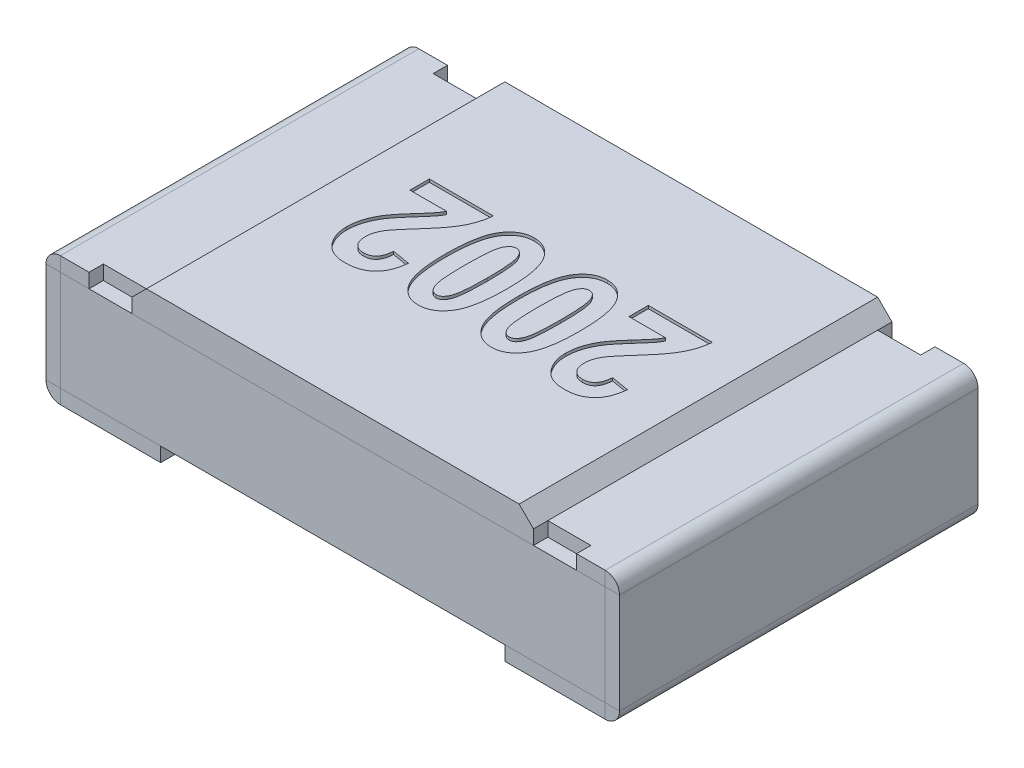
from build123d import *

# Parameters (mm, degrees)
SKETCH1_W              = 1.9
SKETCH1_H              = 1.25
BOSS_EXTRUDE1_DEPTH    = 0.35
SKETCH2_W              = 0.35
SKETCH2_H              = 1.25
BASE_FLANGE1_DEPTH     = 0.05
SM_START               = -0.625
SM_EDGE_FLANGE_1_DEPTH = 1.25
SM_EDGE_FLANGE_2_DEPTH = 1.25
SKETCH14_W             = 0.15
SKETCH14_H             = 0.05
CUT_EXTRUDE1_DEPTH     = 0.05
SKETCH17_W             = 1.4
SKETCH17_H             = 1.25
BOSS_EXTRUDE3_DEPTH    = 0.1
CHAMFER1_SIZE          = 0.05
CUT_EXTRUDE2_DEPTH     = 0.01


# Read off the part's stored shape, not the designer's step: Ребро-кромка1, Ребро-кромка2
# Sheet-metal steps are written as plain solids
with BuildPart() as part:
    # Sketch1 → Boss-Extrude1 (new body)
    with BuildSketch(Plane(origin=(0, 0.05, 0), x_dir=(1, 0, 0), z_dir=(0, 1, 0))):
        Rectangle(SKETCH1_W, SKETCH1_H)
    extrude(amount=BOSS_EXTRUDE1_DEPTH)


with BuildPart() as body_2:
    # Sketch2 → Base-Flange1 (new body)
    with BuildSketch(Plane(origin=(0, 0.05, 0), x_dir=(1, 0, 0), z_dir=(0, 1, 0))):
        with Locations((0.775, 0)):
            Rectangle(SKETCH2_W, SKETCH2_H)
    extrude(amount=-BASE_FLANGE1_DEPTH)

    # Ребро-кромка1 outline → Ребро-кромка1 (add)
    with BuildSketch(Plane.XY.offset(SM_START)):
        with BuildLine():
            Line((0.95, 0.4), (0.95, 0))
            ThreePointArc((0.95, 0), (0.985355339, 0.014644661), (1, 0.05))
            Line((1, 0.05), (1, 0.4))
            Line((1, 0.4), (0.95, 0.4))
        make_face()
    extrude(amount=SM_EDGE_FLANGE_1_DEPTH)

    # Ребро-кромка2 outline → Ребро-кромка2 (add)
    with BuildSketch(Plane.XY.offset(SM_START)):
        with BuildLine():
            Line((0.7, 0.4), (1, 0.4))
            ThreePointArc((1, 0.4), (0.985355339, 0.435355339), (0.95, 0.45))
            Line((0.95, 0.45), (0.7, 0.45))
            Line((0.7, 0.45), (0.7, 0.4))
        make_face()
    extrude(amount=SM_EDGE_FLANGE_2_DEPTH)

    # Sketch14 → Cut-Extrude1 (cut)
    with BuildSketch(Plane(origin=(0, 0.45, 0), x_dir=(1, 0, 0), z_dir=(0, 1, 0))):
        with Locations((0.775, -0.6)):
            Rectangle(SKETCH14_W, SKETCH14_H)
        with Locations((0.775, 0.6)):
            Rectangle(SKETCH14_W, SKETCH14_H)
    extrude(amount=-CUT_EXTRUDE1_DEPTH, mode=Mode.SUBTRACT)


with BuildPart() as body_3:
    # Mirror1: mirrored copy
    add(body_2.part.mirror(Plane(origin=(0, 0, 0), x_dir=(0, 0, 1), z_dir=(1, 0, 0))))


with BuildPart() as body_4:
    # Sketch17 → Boss-Extrude3 (new body)
    with BuildSketch(Plane(origin=(0, 0.4, 0), x_dir=(1, 0, 0), z_dir=(0, 1, 0))):
        Rectangle(SKETCH17_W, SKETCH17_H)
    extrude(amount=BOSS_EXTRUDE3_DEPTH)

    # Chamfer1
    chamfer1_edges = [body_4.edges().sort_by_distance(p)[0] for p in [
        (-0.7, 0.5, 0),
        (0.7, 0.5, 0),
    ]]
    chamfer(chamfer1_edges, length=CHAMFER1_SIZE)

    # Sketch18<2> → Cut-Extrude2 (cut)
    # profile 1 of 4: a face of its own
    with BuildSketch(Plane(origin=(0, 0.5, 0), x_dir=(1, 0, 0), z_dir=(0, 1, 0))):
        with BuildLine():
            Line((0.275324675, 0.132467532), (0.275324675, 0.2))
            Line((0.275324675, 0.2), (0.498701299, 0.2))
            add(Edge.make_bspline(
                [(0.498701299, 0.2), (0.497913144, 0.193349508), (0.496338975, 0.180066594), (0.491616722, 0.160549241), (0.485079536, 0.141537011), (0.478091948, 0.126008074), (0.471123534, 0.113487658), (0.464901061, 0.103265946), (0.457471014, 0.09242231), (0.448974646, 0.080854871), (0.439423397, 0.068564316), (0.42875224, 0.055552761), (0.416979456, 0.041856121), (0.408674017, 0.032561624), (0.404383117, 0.02775974)],
                knots=[0, 0, 0, 0, 1.202815009, 2.402362028, 3.600330928, 4.812516718, 5.456765873, 6.174838876, 6.962514926, 7.818431152, 8.754172199, 9.759747227, 10.84260169, 12, 12, 12, 12], degree=3))
            add(Edge.make_bspline(
                [(0.404383117, 0.02775974), (0.401018629, 0.024007293), (0.394582064, 0.016828525), (0.385528476, 0.006432996), (0.377384801, -0.002915116), (0.370410567, -0.011408794), (0.364360025, -0.018870442), (0.359345611, -0.025413804), (0.355307188, -0.030982158), (0.35314865, -0.034485558), (0.352191558, -0.036038961)],
                knots=[0, 0, 0, 0, 1.465870871, 2.804341841, 4.009590698, 5.071600616, 6.000740577, 6.80347298, 7.469461756, 8, 8, 8, 8], degree=3))
            add(Edge.make_bspline(
                [(0.352191558, -0.036038961), (0.349970292, -0.04001807), (0.345634331, -0.047785379), (0.341119113, -0.060094055), (0.338167782, -0.072424923), (0.337829574, -0.080719786), (0.337662338, -0.084821429)],
                knots=[0, 0, 0, 0, 1.060288104, 2.069705834, 3.04550853, 4, 4, 4, 4], degree=3))
            add(Edge.make_bspline(
                [(0.337662338, -0.084821429), (0.337805275, -0.088919664), (0.338075865, -0.096677885), (0.340417276, -0.107540843), (0.344288335, -0.11687167), (0.349836809, -0.124536437), (0.356741694, -0.130416221), (0.364681712, -0.134669341), (0.373596293, -0.137256403), (0.379879572, -0.137524307), (0.383116883, -0.137662338)],
                knots=[0, 0, 0, 0, 1.245032197, 2.356925714, 3.359432541, 4.295783246, 5.205998414, 6.09309012, 7.017509524, 8, 8, 8, 8], degree=3))
            add(Edge.make_bspline(
                [(0.383116883, -0.137662338), (0.386626091, -0.137508436), (0.393352103, -0.137213456), (0.402820721, -0.134483693), (0.411024407, -0.129937787), (0.417849207, -0.123474175), (0.42325916, -0.115205511), (0.427275216, -0.105189479), (0.429998523, -0.093442161), (0.430763175, -0.084998779), (0.431168831, -0.080519481)],
                knots=[0, 0, 0, 0, 0.999757542, 1.91621054, 2.784003759, 3.652621159, 4.571413543, 5.582410499, 6.717444591, 8, 8, 8, 8], degree=3))
            Line((0.431168831, -0.080519481), (0.493506494, -0.090909091))
            add(Edge.make_bspline(
                [(0.493506494, -0.090909091), (0.492984489, -0.095465963), (0.491971861, -0.104305756), (0.489290707, -0.117003045), (0.48611466, -0.128804701), (0.482140614, -0.139652209), (0.477418529, -0.149550889), (0.471964253, -0.158534612), (0.465798056, -0.166629062), (0.458838611, -0.173728988), (0.451238045, -0.179914446), (0.44308188, -0.185302842), (0.434328247, -0.189876897), (0.424979825, -0.193626842), (0.414977914, -0.196426786), (0.404432524, -0.198565387), (0.393264088, -0.199772732), (0.385635908, -0.199923129), (0.381737013, -0.2)],
                knots=[0, 0, 0, 0, 1.257277449, 2.438969413, 3.555122979, 4.606890186, 5.602584943, 6.558324939, 7.484454118, 8.387006599, 9.278232025, 10.16732337, 11.063477837, 11.98256456, 12.924375971, 13.908137147, 14.9308127, 16, 16, 16, 16], degree=3))
            add(Edge.make_bspline(
                [(0.381737013, -0.2), (0.377457958, -0.199882858), (0.369168573, -0.19965593), (0.357108762, -0.198133762), (0.345915206, -0.195442015), (0.335445696, -0.191811353), (0.325864632, -0.186967377), (0.316968025, -0.181227321), (0.309085121, -0.174197213), (0.301946521, -0.166364549), (0.29578418, -0.157749319), (0.290341489, -0.148818521), (0.285619421, -0.139603258), (0.281975655, -0.129985677), (0.278846879, -0.120156439), (0.276937183, -0.109956897), (0.275514033, -0.099498792), (0.275388449, -0.092402383), (0.275324675, -0.088798701)],
                knots=[0, 0, 0, 0, 1.186211717, 2.297928972, 3.362154236, 4.3727221, 5.362223315, 6.331622294, 7.298958998, 8.281270799, 9.263926147, 10.229953495, 11.179209739, 12.12911764, 13.078136807, 14.034242713, 15.001753863, 16, 16, 16, 16], degree=3))
            add(Edge.make_bspline(
                [(0.275324675, -0.088798701), (0.275394591, -0.084709483), (0.275533855, -0.076564232), (0.276903181, -0.064471278), (0.278984695, -0.052554344), (0.282018315, -0.040810172), (0.285959968, -0.029134129), (0.290757054, -0.017449199), (0.296441894, -0.005717513), (0.302039698, 0.004002911), (0.307055473, 0.012078481), (0.31152186, 0.018533348), (0.316611977, 0.025365694), (0.322183114, 0.032690481), (0.328453718, 0.040366713), (0.335270872, 0.048485742), (0.342658413, 0.057009415), (0.347827065, 0.06277804), (0.350487013, 0.065746753)],
                knots=[0, 0, 0, 0, 1.112563442, 2.216097518, 3.308146812, 4.402998112, 5.513781081, 6.65974264, 7.838800208, 9.05908204, 9.710862989, 10.42577165, 11.194588916, 12.029705768, 12.930215825, 13.891935437, 14.915124831, 16, 16, 16, 16], degree=3))
            add(Edge.make_bspline(
                [(0.350487013, 0.065746753), (0.3529571, 0.068472335), (0.357679959, 0.073683706), (0.36428664, 0.081222163), (0.370238965, 0.087986292), (0.375510433, 0.093972901), (0.380092428, 0.099245989), (0.383865467, 0.103854386), (0.386975681, 0.107697587), (0.391544801, 0.113426355), (0.397004356, 0.121495164), (0.400952044, 0.12891658), (0.402840909, 0.132467532)],
                knots=[0, 0, 0, 0, 1.297119841, 2.480120354, 3.534763852, 4.474517179, 5.293121491, 5.998013172, 6.574687284, 7.036626064, 8.582103637, 10, 10, 10, 10], degree=3))
            Line((0.402840909, 0.132467532), (0.275324675, 0.132467532))
        make_face()
    # profile 2 of 4: a face of its own
    with BuildSketch(Plane(origin=(0, 0.5, 0), x_dir=(1, 0, 0), z_dir=(0, 1, 0))):
        with BuildLine():
            add(Edge.make_bspline(
                [(0.127435065, -0.2), (0.123556318, -0.199857434), (0.115902711, -0.19957612), (0.104735887, -0.197413383), (0.094105107, -0.193899722), (0.084083819, -0.188915172), (0.074665899, -0.182495134), (0.065827688, -0.174678766), (0.057562257, -0.165469418), (0.049816451, -0.154784436), (0.042855814, -0.142287813), (0.03691096, -0.127754663), (0.031918262, -0.111134807), (0.02784994, -0.092430259), (0.024622662, -0.071614446), (0.022437108, -0.048685459), (0.021045624, -0.023664395), (0.020870348, -0.006279065), (0.020779221, 0.00275974)],
                knots=[0, 0, 0, 0, 0.727503026, 1.435521033, 2.125933754, 2.823035237, 3.52857293, 4.258887692, 5.031802202, 5.846339271, 6.730577678, 7.709342118, 8.787052798, 9.983216815, 11.298799232, 12.737663191, 14.303878888, 16, 16, 16, 16], degree=3))
            add(Edge.make_bspline(
                [(0.020779221, 0.00275974), (0.020870548, 0.011771451), (0.021046187, 0.029102634), (0.022434565, 0.054043203), (0.024632394, 0.076915874), (0.027833454, 0.097683332), (0.031950604, 0.116374335), (0.036872915, 0.132990657), (0.042879948, 0.147499029), (0.049808946, 0.159984707), (0.057569123, 0.170634273), (0.065744551, 0.179898955), (0.074587199, 0.187689606), (0.08398713, 0.194085522), (0.093959423, 0.199116834), (0.10452607, 0.20257983), (0.11562846, 0.204786725), (0.123230712, 0.205056917), (0.12711039, 0.205194805)],
                knots=[0, 0, 0, 0, 1.695059366, 3.259911835, 4.697127445, 6.015833273, 7.209868934, 8.295006778, 9.271397414, 10.15773515, 10.974206064, 11.745554658, 12.477603308, 13.184816065, 13.879016739, 14.571068615, 15.270769761, 16, 16, 16, 16], degree=3))
            add(Edge.make_bspline(
                [(0.12711039, 0.205194805), (0.130987127, 0.205042453), (0.138631819, 0.204742025), (0.149822721, 0.202721873), (0.16041548, 0.199148087), (0.170486818, 0.19429561), (0.179850815, 0.187842178), (0.188719121, 0.180126252), (0.196988962, 0.170995059), (0.203282887, 0.162318013), (0.208013912, 0.154643874), (0.211314495, 0.148225461), (0.214390672, 0.141273959), (0.2173518, 0.133828826), (0.21988857, 0.125744214), (0.222338239, 0.117174056), (0.224521405, 0.10807297), (0.226450622, 0.098427606), (0.228272862, 0.088263723), (0.229664037, 0.077500558), (0.231024836, 0.066254389), (0.231930447, 0.054416131), (0.232777374, 0.042080629), (0.233299339, 0.029169507), (0.233767992, 0.015750096), (0.233766827, 0.006602198), (0.233766234, 0.001948052)],
                knots=[0, 0, 0, 0, 1.088282887, 2.146027983, 3.178826917, 4.218279349, 5.273703959, 6.361191414, 7.511779163, 8.724110884, 9.365006532, 10.041034625, 10.748217649, 11.498582071, 12.288826199, 13.125555753, 14.000603745, 14.915204017, 15.88669545, 16.898559194, 17.961282966, 19.066372579, 20.230939374, 21.432180567, 22.693579123, 24, 24, 24, 24], degree=3))
            add(Edge.make_bspline(
                [(0.233766234, 0.001948052), (0.233675171, -0.007036653), (0.233500062, -0.024313857), (0.232108657, -0.049172772), (0.229924189, -0.071939776), (0.226690725, -0.092619949), (0.222611933, -0.111238668), (0.217655644, -0.12781776), (0.211667116, -0.142304698), (0.204736131, -0.154789791), (0.196976424, -0.165439494), (0.188800881, -0.174704143), (0.179958261, -0.182494803), (0.170558323, -0.188890716), (0.160586032, -0.193922029), (0.150019384, -0.197385024), (0.138916995, -0.199591919), (0.131314742, -0.199862112), (0.127435065, -0.2)],
                knots=[0, 0, 0, 0, 1.69316225, 3.255878705, 4.690734649, 6.001855936, 7.198146525, 8.280455951, 9.258690493, 10.146702072, 10.964714887, 11.737520167, 12.470951286, 13.179499609, 13.875011277, 14.568370088, 15.269392615, 16, 16, 16, 16], degree=3))
        make_face()
        with BuildLine():
            add(Edge.make_bspline(
                [(0.127272727, -0.137662338), (0.128714309, -0.137579426), (0.131588032, -0.137414146), (0.135767049, -0.136228507), (0.139743954, -0.134342522), (0.143440872, -0.131595888), (0.146815972, -0.128060086), (0.150030129, -0.123841879), (0.153020548, -0.118862777), (0.155866854, -0.112915556), (0.158487593, -0.105498009), (0.160408604, -0.096123943), (0.1623201, -0.084763042), (0.163665778, -0.071282468), (0.164921507, -0.055753966), (0.165659799, -0.03810098), (0.166156133, -0.018374202), (0.166207029, -0.004518801), (0.166233766, 0.00275974)],
                knots=[0, 0, 0, 0, 0.441218712, 0.87954774, 1.320688601, 1.783190269, 2.281372209, 2.813490262, 3.404797085, 4.057243347, 4.830526213, 5.807711728, 6.983597402, 8.359244128, 9.955404635, 11.755826947, 13.770444526, 16, 16, 16, 16], degree=3))
            add(Edge.make_bspline(
                [(0.166233766, 0.00275974), (0.166207368, 0.010038289), (0.166157213, 0.023866658), (0.165658081, 0.043566305), (0.164921925, 0.061192294), (0.163664804, 0.076720737), (0.162325585, 0.090174901), (0.1604143, 0.101483305), (0.158470708, 0.110796177), (0.155888349, 0.118173993), (0.153004851, 0.124079249), (0.149999378, 0.129038546), (0.146871349, 0.133330841), (0.143409471, 0.136787239), (0.139747877, 0.13954104), (0.135766031, 0.141422349), (0.131588287, 0.142609193), (0.128714395, 0.142774312), (0.127272727, 0.142857143)],
                knots=[0, 0, 0, 0, 2.233925394, 4.24418983, 6.048140963, 7.647429939, 9.025772927, 10.195769628, 11.166772259, 11.941570756, 12.587815933, 13.180281715, 13.720062895, 14.213314685, 14.676722855, 15.11872835, 15.557916501, 16, 16, 16, 16], degree=3))
            add(Edge.make_bspline(
                [(0.127272727, 0.142857143), (0.125804058, 0.142776027), (0.122903125, 0.142615807), (0.118694432, 0.141426978), (0.114711298, 0.139513267), (0.110944748, 0.136822484), (0.10755397, 0.13321627), (0.104273848, 0.12901585), (0.101387119, 0.123946403), (0.098489074, 0.11805017), (0.096024481, 0.110613355), (0.094037326, 0.101325268), (0.092147623, 0.090010737), (0.090777761, 0.076589538), (0.089654105, 0.061079587), (0.088877342, 0.043485936), (0.088391872, 0.023812302), (0.088339307, 0.010011149), (0.088311688, 0.00275974)],
                knots=[0, 0, 0, 0, 0.450092843, 0.889028465, 1.330779811, 1.80063996, 2.299511324, 2.844002349, 3.431866051, 4.085215219, 4.856850318, 5.827294631, 6.996618595, 8.374169049, 9.963635982, 11.76654986, 13.775658413, 16, 16, 16, 16], degree=3))
            add(Edge.make_bspline(
                [(0.088311688, 0.00275974), (0.088339537, -0.004518712), (0.088392551, -0.018373944), (0.088874682, -0.038101858), (0.089658547, -0.055749157), (0.090772236, -0.071286968), (0.092154147, -0.084760881), (0.0940409, -0.096129183), (0.096013266, -0.105474933), (0.098488057, -0.112937699), (0.101392127, -0.118828813), (0.104246664, -0.123896444), (0.107581177, -0.12802736), (0.110941704, -0.131630043), (0.114712039, -0.134317885), (0.118694241, -0.136232321), (0.122903174, -0.137420964), (0.125804074, -0.137581209), (0.127272727, -0.137662338)],
                knots=[0, 0, 0, 0, 2.227823008, 4.240875137, 6.039898439, 7.634194999, 9.008772785, 10.183744742, 11.16017094, 11.930140898, 12.582080179, 13.168675308, 13.705450879, 14.203245709, 14.672091929, 15.112890003, 15.55087843, 16, 16, 16, 16], degree=3))
        make_face(mode=Mode.SUBTRACT)
    # profile 3 of 4: a face of its own
    with BuildSketch(Plane(origin=(0, 0.5, 0), x_dir=(1, 0, 0), z_dir=(0, 1, 0))):
        with BuildLine():
            add(Edge.make_bspline(
                [(-0.12711039, -0.2), (-0.130989136, -0.199857434), (-0.138642743, -0.19957612), (-0.149809568, -0.197413383), (-0.160440347, -0.193899722), (-0.170461636, -0.188915172), (-0.179879555, -0.182495134), (-0.188717767, -0.174678766), (-0.196983198, -0.165469418), (-0.204729003, -0.154784436), (-0.211689641, -0.142287813), (-0.217634495, -0.127754663), (-0.222627192, -0.111134807), (-0.226695515, -0.092430259), (-0.229922793, -0.071614446), (-0.232108347, -0.048685459), (-0.23349983, -0.023664395), (-0.233675106, -0.006279065), (-0.233766234, 0.00275974)],
                knots=[0, 0, 0, 0, 0.727503026, 1.435521033, 2.125933754, 2.823035237, 3.52857293, 4.258887692, 5.031802202, 5.846339271, 6.730577678, 7.709342118, 8.787052798, 9.983216815, 11.298799232, 12.737663191, 14.303878888, 16, 16, 16, 16], degree=3))
            add(Edge.make_bspline(
                [(-0.233766234, 0.00275974), (-0.233674907, 0.011771451), (-0.233499268, 0.029102634), (-0.23211089, 0.054043203), (-0.229913061, 0.076915874), (-0.226712, 0.097683332), (-0.22259485, 0.116374335), (-0.217672539, 0.132990657), (-0.211665506, 0.147499029), (-0.204736509, 0.159984707), (-0.196976332, 0.170634273), (-0.188800903, 0.179898955), (-0.179958255, 0.187689606), (-0.170558325, 0.194085522), (-0.160586032, 0.199116834), (-0.150019384, 0.20257983), (-0.138916995, 0.204786725), (-0.131314742, 0.205056917), (-0.127435065, 0.205194805)],
                knots=[0, 0, 0, 0, 1.695059366, 3.259911835, 4.697127445, 6.015833273, 7.209868934, 8.295006778, 9.271397414, 10.15773515, 10.974206064, 11.745554658, 12.477603308, 13.184816065, 13.879016739, 14.571068615, 15.270769761, 16, 16, 16, 16], degree=3))
            add(Edge.make_bspline(
                [(-0.127435065, 0.205194805), (-0.123558328, 0.205042453), (-0.115913636, 0.204742025), (-0.104722733, 0.202721873), (-0.094129975, 0.199148087), (-0.084058636, 0.19429561), (-0.074694639, 0.187842178), (-0.065826333, 0.180126252), (-0.057556493, 0.170995059), (-0.051262568, 0.162318013), (-0.046531542, 0.154643874), (-0.04323096, 0.148225461), (-0.040154783, 0.141273959), (-0.037193654, 0.133828826), (-0.034656884, 0.125744214), (-0.032207216, 0.117174056), (-0.03002405, 0.10807297), (-0.028094833, 0.098427606), (-0.026272593, 0.088263723), (-0.024881418, 0.077500558), (-0.023520619, 0.066254389), (-0.022615007, 0.054416131), (-0.021768081, 0.042080629), (-0.021246115, 0.029169507), (-0.020777463, 0.015750096), (-0.020778628, 0.006602198), (-0.020779221, 0.001948052)],
                knots=[0, 0, 0, 0, 1.088282887, 2.146027983, 3.178826917, 4.218279349, 5.273703959, 6.361191414, 7.511779163, 8.724110884, 9.365006532, 10.041034625, 10.748217649, 11.498582071, 12.288826199, 13.125555753, 14.000603745, 14.915204017, 15.88669545, 16.898559194, 17.961282966, 19.066372579, 20.230939374, 21.432180567, 22.693579123, 24, 24, 24, 24], degree=3))
            add(Edge.make_bspline(
                [(-0.020779221, 0.001948052), (-0.020870283, -0.007036653), (-0.021045393, -0.024313857), (-0.022436797, -0.049172772), (-0.024621265, -0.071939776), (-0.02785473, -0.092619949), (-0.031933521, -0.111238668), (-0.036889811, -0.12781776), (-0.042878338, -0.142304698), (-0.049809324, -0.154789791), (-0.057569031, -0.165439494), (-0.065744574, -0.174704143), (-0.074587194, -0.182494803), (-0.083987131, -0.188890716), (-0.093959423, -0.193922029), (-0.10452607, -0.197385024), (-0.11562846, -0.199591919), (-0.123230712, -0.199862112), (-0.12711039, -0.2)],
                knots=[0, 0, 0, 0, 1.69316225, 3.255878705, 4.690734649, 6.001855936, 7.198146525, 8.280455951, 9.258690493, 10.146702072, 10.964714887, 11.737520167, 12.470951286, 13.179499609, 13.875011277, 14.568370088, 15.269392615, 16, 16, 16, 16], degree=3))
        make_face()
        with BuildLine():
            add(Edge.make_bspline(
                [(-0.127272727, -0.137662338), (-0.125831145, -0.137579426), (-0.122957423, -0.137414146), (-0.118778406, -0.136228507), (-0.1148015, -0.134342522), (-0.111104583, -0.131595888), (-0.107729482, -0.128060086), (-0.104515325, -0.123841879), (-0.101524907, -0.118862777), (-0.098678601, -0.112915556), (-0.096057861, -0.105498009), (-0.094136851, -0.096123943), (-0.092225354, -0.084763042), (-0.090879677, -0.071282468), (-0.089623947, -0.055753966), (-0.088885656, -0.03810098), (-0.088389321, -0.018374202), (-0.088338425, -0.004518801), (-0.088311688, 0.00275974)],
                knots=[0, 0, 0, 0, 0.441218712, 0.87954774, 1.320688601, 1.783190269, 2.281372209, 2.813490262, 3.404797085, 4.057243347, 4.830526213, 5.807711728, 6.983597402, 8.359244128, 9.955404635, 11.755826947, 13.770444526, 16, 16, 16, 16], degree=3))
            add(Edge.make_bspline(
                [(-0.088311688, 0.00275974), (-0.088338087, 0.010038289), (-0.088388241, 0.023866658), (-0.088887373, 0.043566305), (-0.089623529, 0.061192294), (-0.09088065, 0.076720737), (-0.092219869, 0.090174901), (-0.094131154, 0.101483305), (-0.096074747, 0.110796177), (-0.098657106, 0.118173993), (-0.101540604, 0.124079249), (-0.104546077, 0.129038546), (-0.107674105, 0.133330841), (-0.111135984, 0.136787239), (-0.114797578, 0.13954104), (-0.118779423, 0.141422349), (-0.122957167, 0.142609193), (-0.12583106, 0.142774312), (-0.127272727, 0.142857143)],
                knots=[0, 0, 0, 0, 2.233925394, 4.24418983, 6.048140963, 7.647429939, 9.025772927, 10.195769628, 11.166772259, 11.941570756, 12.587815933, 13.180281715, 13.720062895, 14.213314685, 14.676722855, 15.11872835, 15.557916501, 16, 16, 16, 16], degree=3))
            add(Edge.make_bspline(
                [(-0.127272727, 0.142857143), (-0.128741397, 0.142776027), (-0.13164233, 0.142615807), (-0.135851023, 0.141426978), (-0.139834157, 0.139513267), (-0.143600707, 0.136822484), (-0.146991484, 0.13321627), (-0.150271607, 0.12901585), (-0.153158336, 0.123946403), (-0.15605638, 0.11805017), (-0.158520973, 0.110613355), (-0.160508129, 0.101325268), (-0.162397832, 0.090010737), (-0.163767693, 0.076589538), (-0.16489135, 0.061079587), (-0.165668112, 0.043485936), (-0.166153583, 0.023812302), (-0.166206148, 0.010011149), (-0.166233766, 0.00275974)],
                knots=[0, 0, 0, 0, 0.450092843, 0.889028465, 1.330779811, 1.80063996, 2.299511324, 2.844002349, 3.431866051, 4.085215219, 4.856850318, 5.827294631, 6.996618595, 8.374169049, 9.963635982, 11.76654986, 13.775658413, 16, 16, 16, 16], degree=3))
            add(Edge.make_bspline(
                [(-0.166233766, 0.00275974), (-0.166205917, -0.004518712), (-0.166152904, -0.018373944), (-0.165670773, -0.038101858), (-0.164886907, -0.055749157), (-0.163773218, -0.071286968), (-0.162391307, -0.084760881), (-0.160504554, -0.096129183), (-0.158532189, -0.105474933), (-0.156057398, -0.112937699), (-0.153153328, -0.118828813), (-0.15029879, -0.123896444), (-0.146964278, -0.12802736), (-0.14360375, -0.131630043), (-0.139833415, -0.134317885), (-0.135851214, -0.136232321), (-0.131642281, -0.137420964), (-0.12874138, -0.137581209), (-0.127272727, -0.137662338)],
                knots=[0, 0, 0, 0, 2.227823008, 4.240875137, 6.039898439, 7.634194999, 9.008772785, 10.183744742, 11.16017094, 11.930140898, 12.582080179, 13.168675308, 13.705450879, 14.203245709, 14.672091929, 15.112890003, 15.55087843, 16, 16, 16, 16], degree=3))
        make_face(mode=Mode.SUBTRACT)
    # profile 4 of 4: a face of its own
    with BuildSketch(Plane(origin=(0, 0.5, 0), x_dir=(1, 0, 0), z_dir=(0, 1, 0))):
        with BuildLine():
            Line((-0.488311688, 0.132467532), (-0.488311688, 0.2))
            Line((-0.488311688, 0.2), (-0.264935065, 0.2))
            add(Edge.make_bspline(
                [(-0.264935065, 0.2), (-0.26572322, 0.193349508), (-0.267297388, 0.180066594), (-0.272019642, 0.160549241), (-0.278556827, 0.141537011), (-0.285544416, 0.126008074), (-0.29251283, 0.113487658), (-0.298735303, 0.103265946), (-0.30616535, 0.09242231), (-0.314661717, 0.080854871), (-0.324212967, 0.068564316), (-0.334884123, 0.055552761), (-0.346656908, 0.041856121), (-0.354962347, 0.032561624), (-0.359253247, 0.02775974)],
                knots=[0, 0, 0, 0, 1.202815009, 2.402362028, 3.600330928, 4.812516718, 5.456765873, 6.174838876, 6.962514926, 7.818431152, 8.754172199, 9.759747227, 10.84260169, 12, 12, 12, 12], degree=3))
            add(Edge.make_bspline(
                [(-0.359253247, 0.02775974), (-0.362617734, 0.024007293), (-0.369054299, 0.016828525), (-0.378107887, 0.006432996), (-0.386251562, -0.002915116), (-0.393225797, -0.011408794), (-0.399276339, -0.018870442), (-0.404290753, -0.025413804), (-0.408329176, -0.030982158), (-0.410487713, -0.034485558), (-0.411444805, -0.036038961)],
                knots=[0, 0, 0, 0, 1.465870871, 2.804341841, 4.009590698, 5.071600616, 6.000740577, 6.80347298, 7.469461756, 8, 8, 8, 8], degree=3))
            add(Edge.make_bspline(
                [(-0.411444805, -0.036038961), (-0.413666072, -0.04001807), (-0.418002033, -0.047785379), (-0.422517251, -0.060094055), (-0.425468582, -0.072424923), (-0.425806789, -0.080719786), (-0.425974026, -0.084821429)],
                knots=[0, 0, 0, 0, 1.060288104, 2.069705834, 3.04550853, 4, 4, 4, 4], degree=3))
            add(Edge.make_bspline(
                [(-0.425974026, -0.084821429), (-0.425831088, -0.088919664), (-0.425560498, -0.096677885), (-0.423219087, -0.107540843), (-0.419348029, -0.11687167), (-0.413799555, -0.124536437), (-0.40689467, -0.130416221), (-0.398954651, -0.134669341), (-0.39004007, -0.137256403), (-0.383756792, -0.137524307), (-0.380519481, -0.137662338)],
                knots=[0, 0, 0, 0, 1.245032197, 2.356925714, 3.359432541, 4.295783246, 5.205998414, 6.09309012, 7.017509524, 8, 8, 8, 8], degree=3))
            add(Edge.make_bspline(
                [(-0.380519481, -0.137662338), (-0.377010272, -0.137508436), (-0.37028426, -0.137213456), (-0.360815642, -0.134483693), (-0.352611957, -0.129937787), (-0.345787157, -0.123474175), (-0.340377204, -0.115205511), (-0.336361148, -0.105189479), (-0.333637841, -0.093442161), (-0.332873188, -0.084998779), (-0.332467532, -0.080519481)],
                knots=[0, 0, 0, 0, 0.999757542, 1.91621054, 2.784003759, 3.652621159, 4.571413543, 5.582410499, 6.717444591, 8, 8, 8, 8], degree=3))
            Line((-0.332467532, -0.080519481), (-0.27012987, -0.090909091))
            add(Edge.make_bspline(
                [(-0.27012987, -0.090909091), (-0.270651875, -0.095465963), (-0.271664503, -0.104305756), (-0.274345656, -0.117003045), (-0.277521704, -0.128804701), (-0.28149575, -0.139652209), (-0.286217835, -0.149550889), (-0.291672111, -0.158534612), (-0.297838308, -0.166629062), (-0.304797753, -0.173728988), (-0.312398319, -0.179914446), (-0.320554483, -0.185302842), (-0.329308117, -0.189876897), (-0.338656539, -0.193626842), (-0.34865845, -0.196426786), (-0.35920384, -0.198565387), (-0.370372275, -0.199772732), (-0.378000456, -0.199923129), (-0.381899351, -0.2)],
                knots=[0, 0, 0, 0, 1.257277449, 2.438969413, 3.555122979, 4.606890186, 5.602584943, 6.558324939, 7.484454118, 8.387006599, 9.278232025, 10.16732337, 11.063477837, 11.98256456, 12.924375971, 13.908137147, 14.9308127, 16, 16, 16, 16], degree=3))
            add(Edge.make_bspline(
                [(-0.381899351, -0.2), (-0.386178406, -0.199882858), (-0.394467791, -0.19965593), (-0.406527602, -0.198133762), (-0.417721158, -0.195442015), (-0.428190668, -0.191811353), (-0.437771732, -0.186967377), (-0.446668339, -0.181227321), (-0.454551243, -0.174197213), (-0.461689842, -0.166364549), (-0.467852184, -0.157749319), (-0.473294875, -0.148818521), (-0.478016943, -0.139603258), (-0.481660709, -0.129985677), (-0.484789485, -0.120156439), (-0.48669918, -0.109956897), (-0.488122331, -0.099498792), (-0.488247915, -0.092402383), (-0.488311688, -0.088798701)],
                knots=[0, 0, 0, 0, 1.186211717, 2.297928972, 3.362154236, 4.3727221, 5.362223315, 6.331622294, 7.298958998, 8.281270799, 9.263926147, 10.229953495, 11.179209739, 12.12911764, 13.078136807, 14.034242713, 15.001753863, 16, 16, 16, 16], degree=3))
            add(Edge.make_bspline(
                [(-0.488311688, -0.088798701), (-0.488241773, -0.084709483), (-0.488102509, -0.076564232), (-0.486733183, -0.064471278), (-0.484651668, -0.052554344), (-0.481618049, -0.040810172), (-0.477676396, -0.029134129), (-0.47287931, -0.017449199), (-0.46719447, -0.005717513), (-0.461596665, 0.004002911), (-0.456580891, 0.012078481), (-0.452114504, 0.018533348), (-0.447024386, 0.025365694), (-0.441453249, 0.032690481), (-0.435182646, 0.040366713), (-0.428365492, 0.048485742), (-0.420977951, 0.057009415), (-0.415809299, 0.06277804), (-0.413149351, 0.065746753)],
                knots=[0, 0, 0, 0, 1.112563442, 2.216097518, 3.308146812, 4.402998112, 5.513781081, 6.65974264, 7.838800208, 9.05908204, 9.710862989, 10.42577165, 11.194588916, 12.029705768, 12.930215825, 13.891935437, 14.915124831, 16, 16, 16, 16], degree=3))
            add(Edge.make_bspline(
                [(-0.413149351, 0.065746753), (-0.410679263, 0.068472335), (-0.405956405, 0.073683706), (-0.399349723, 0.081222163), (-0.393397398, 0.087986292), (-0.388125931, 0.093972901), (-0.383543935, 0.099245989), (-0.379770897, 0.103854386), (-0.376660683, 0.107697587), (-0.372091563, 0.113426355), (-0.366632008, 0.121495164), (-0.362684319, 0.12891658), (-0.360795455, 0.132467532)],
                knots=[0, 0, 0, 0, 1.297119841, 2.480120354, 3.534763852, 4.474517179, 5.293121491, 5.998013172, 6.574687284, 7.036626064, 8.582103637, 10, 10, 10, 10], degree=3))
            Line((-0.360795455, 0.132467532), (-0.488311688, 0.132467532))
        make_face()
    extrude(amount=-CUT_EXTRUDE2_DEPTH, mode=Mode.SUBTRACT)


solid = Compound([part.part, body_2.part, body_3.part, body_4.part])
